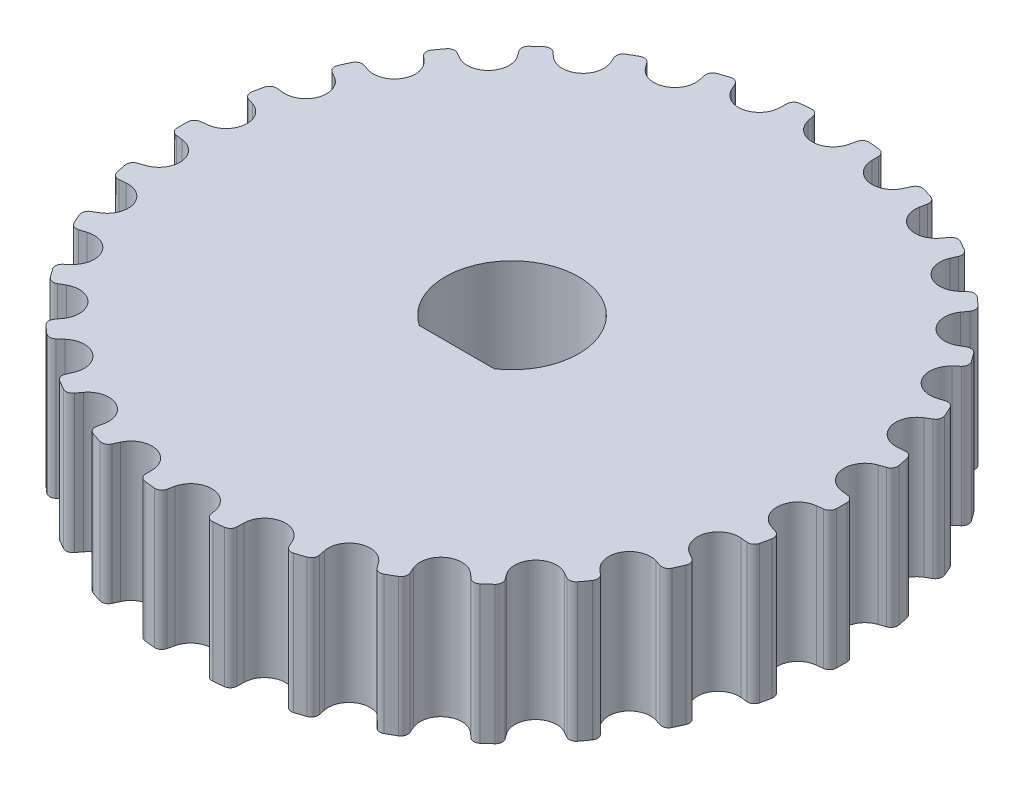
from build123d import *

# Parameters (mm, degrees)
SKETCH1_R           = 14.323944878
BOSS_EXTRUDE1_DEPTH = 6
CUT_EXTRUDE1_DEPTH  = 22.127015732
CIRPATTERN1_COUNT   = 30
CUT_EXTRUDE2_DEPTH  = 22.08964236


with BuildPart() as part:
    # Sketch1 → Boss-Extrude1 (new body)
    with BuildSketch(Plane(origin=(0, 0, 0), x_dir=(1, 0, 0), z_dir=(0, 1, 0))):
        Circle(SKETCH1_R)
    extrude(amount=BOSS_EXTRUDE1_DEPTH)

    # Sketch2 → Cut-Extrude1 (cut, through all)
    with BuildSketch(Plane(origin=(0, 6, 0), x_dir=(1, 0, 0), z_dir=(0, 1, 0))):
        with BuildLine():
            Line((-0.88830444, 13.756422166), (-0.95, 14.033881093))
            ThreePointArc((-0.95, 14.033881093), (-1.065709647, 14.210883809), (-1.269434594, 14.267583281))
            ThreePointArc((-1.269434594, 14.267583281), (-2.127648488, 14.165045315), (-2.978115599, 14.010932316))
            Line((-2.978115599, 14.010932316), (-2.978115599, 14.323944878))
            Line((-2.978115599, 14.323944878), (2.978115599, 14.323944878))
            Line((2.978115599, 14.323944878), (2.978115599, 14.010932316))
            ThreePointArc((2.978115599, 14.010932316), (2.127648488, 14.165045315), (1.269434594, 14.267583281))
            ThreePointArc((1.269434594, 14.267583281), (1.065709647, 14.210883809), (0.95, 14.033881093))
            Line((0.95, 14.033881093), (0.88830444, 13.756422166))
            ThreePointArc((0.88830444, 13.756422166), (0, 13.043944878), (-0.88830444, 13.756422166))
        make_face()
    cut_extrude1 = extrude(amount=-CUT_EXTRUDE1_DEPTH, mode=Mode.SUBTRACT)

    # CirPattern1: Cut-Extrude1 ×30 about axis
    cirpattern1_axis = Axis((0, 6, 0), (0, -1, 0))
    for i in range(1, CIRPATTERN1_COUNT):
        add(cut_extrude1.rotate(cirpattern1_axis, i * 360 / CIRPATTERN1_COUNT), mode=Mode.SUBTRACT)

    # Sketch3 → Cut-Extrude2 (cut, through all)
    with BuildSketch(Plane.XZ):
        with BuildLine():
            Line((1.62788206, 2.4), (-1.62788206, 2.4))
            ThreePointArc((-1.62788206, 2.4), (0, -2.9), (1.62788206, 2.4))
        make_face()
    extrude(amount=-CUT_EXTRUDE2_DEPTH, mode=Mode.SUBTRACT)


solid = part.part
